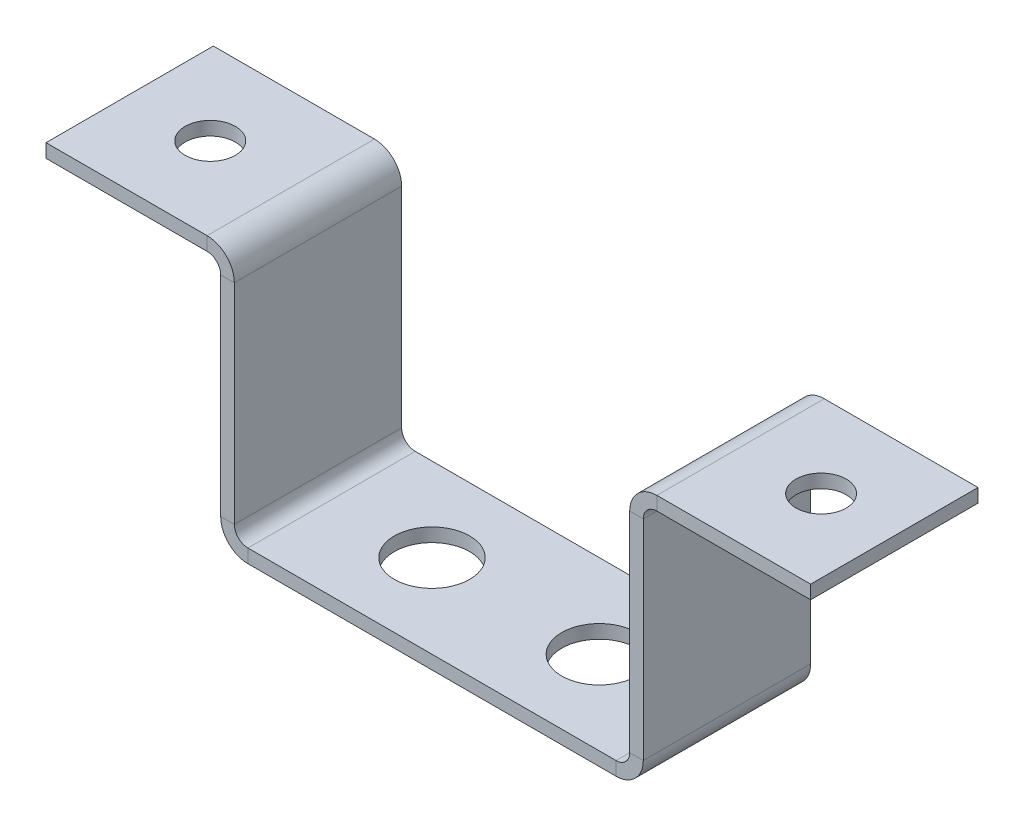
from build123d import *

# Parameters (mm, degrees)
SKETCH2_W                    = 22
SKETCH2_H                    = 10
BOSS_EXTRUDE1_DEPTH          = 0.8128
EDGE_FLANGE1_DEPTH           = 10
EDGE_FLANGE2_DEPTH           = 10
EDGE_FLANGE3_STRIP_W         = 4.8768
EDGE_FLANGE3_STRIP_H         = 0.8128
EDGE_FLANGE3_STRIP_CUT_DEPTH = 10
EDGE_FLANGE3_DEPTH           = 10
EDGE_FLANGE4_STRIP_W         = 4.8768
EDGE_FLANGE4_STRIP_H         = 0.8128
EDGE_FLANGE4_STRIP_CUT_DEPTH = 10
EDGE_FLANGE4_DEPTH           = 10
CUT_EXTRUDE1_REACH           = 40.457
SKETCH21_R                   = 1.5
CUT_EXTRUDE2_REACH           = 40.457
SKETCH22_R                   = 2.25


# Sheet-metal steps are written as plain solids
with BuildPart() as part:
    # Sketch2 → Boss-Extrude1 (new body)
    with BuildSketch(Plane(origin=(0, 0, 0), x_dir=(1, 0, 0), z_dir=(0, 1, 0))):
        with Locations((11, 5)):
            Rectangle(SKETCH2_W, SKETCH2_H)
    extrude(amount=BOSS_EXTRUDE1_DEPTH)

    # Edge-Flange1 section (across the edge) → Edge-Flange1 (add)
    with BuildSketch(Plane(origin=(-0.8128, 0.8128, -10), x_dir=(1, 0, 0), z_dir=(0, 0, 1))):
        with BuildLine():
            Line((-0.8128, 0.8128), (-0.8128, 14.13))
            Line((-0.8128, 14.13), (0, 14.13))
            Line((0, 14.13), (0, 0.8128))
            ThreePointArc((0, 0.8128), (0.238063608, 0.238063608), (0.8128, 0))
            Line((0.8128, 0), (0.8128, -0.8128))
            ThreePointArc((0.8128, -0.8128), (-0.336672783, -0.336672783), (-0.8128, 0.8128))
        make_face()
    extrude(amount=EDGE_FLANGE1_DEPTH)

    # Edge-Flange2 section (across the edge) → Edge-Flange2 (add)
    with BuildSketch(Plane(origin=(22.8128, 0.8128, 0), x_dir=(-1, 0, 0), z_dir=(0, 0, -1))):
        with BuildLine():
            Line((-0.8128, 0.8128), (-0.8128, 14.13))
            Line((-0.8128, 14.13), (0, 14.13))
            Line((0, 14.13), (0, 0.8128))
            ThreePointArc((0, 0.8128), (0.238063608, 0.238063608), (0.8128, 0))
            Line((0.8128, 0), (0.8128, -0.8128))
            ThreePointArc((0.8128, -0.8128), (-0.336672783, -0.336672783), (-0.8128, 0.8128))
        make_face()
    extrude(amount=EDGE_FLANGE2_DEPTH)

    # Edge-Flange3 strip (across the edge) → Edge-Flange3 strip cut (cut)
    with BuildSketch(Plane(origin=(-1.6256, 14.9428, 0), x_dir=(0, -1, 0), z_dir=(0, 0, -1))):
        with Locations((-1.6256, -0.4064)):
            Rectangle(EDGE_FLANGE3_STRIP_W, EDGE_FLANGE3_STRIP_H)
    extrude(amount=EDGE_FLANGE3_STRIP_CUT_DEPTH, mode=Mode.SUBTRACT)

    # Edge-Flange3 section (across the edge) → Edge-Flange3 (add)
    with BuildSketch(Plane(origin=(-1.6256, 14.9428, 0), x_dir=(0, -1, 0), z_dir=(0, 0, -1))):
        with BuildLine():
            Line((-0.8128, 0.8128), (-0.8128, 10.4384))
            Line((-0.8128, 10.4384), (0, 10.4384))
            Line((0, 10.4384), (0, 0.8128))
            ThreePointArc((0, 0.8128), (0.238063608, 0.238063608), (0.8128, 0))
            Line((0.8128, 0), (0.8128, -0.8128))
            ThreePointArc((0.8128, -0.8128), (-0.336672783, -0.336672783), (-0.8128, 0.8128))
        make_face()
    extrude(amount=EDGE_FLANGE3_DEPTH)

    # Edge-Flange4 strip (across the edge) → Edge-Flange4 strip cut (cut)
    with BuildSketch(Plane(origin=(23.6256, 14.9428, -10), x_dir=(0, -1, 0), z_dir=(0, 0, 1))):
        with Locations((-1.6256, -0.4064)):
            Rectangle(EDGE_FLANGE4_STRIP_W, EDGE_FLANGE4_STRIP_H)
    extrude(amount=EDGE_FLANGE4_STRIP_CUT_DEPTH, mode=Mode.SUBTRACT)

    # Edge-Flange4 section (across the edge) → Edge-Flange4 (add)
    with BuildSketch(Plane(origin=(23.6256, 14.9428, -10), x_dir=(0, -1, 0), z_dir=(0, 0, 1))):
        with BuildLine():
            Line((-0.8128, 0.8128), (-0.8128, 10))
            Line((-0.8128, 10), (0, 10))
            Line((0, 10), (0, 0.8128))
            ThreePointArc((0, 0.8128), (0.238063608, 0.238063608), (0.8128, 0))
            Line((0.8128, 0), (0.8128, -0.8128))
            ThreePointArc((0.8128, -0.8128), (-0.336672783, -0.336672783), (-0.8128, 0.8128))
        make_face()
    extrude(amount=EDGE_FLANGE4_DEPTH)

    # Sketch21 → Cut-Extrude1 (cut, up to next)
    with BuildSketch(Plane(origin=(0, 15.7556, 0), x_dir=(1, 0, 0), z_dir=(0, 1, 0)), mode=Mode.PRIVATE) as cut_extrude1_sk1:
        with Locations(Location((-7.2512, 5, 0), (0, 0, 270))):
            Circle(SKETCH21_R)
    cut_extrude1_tool1 = extrude(cut_extrude1_sk1.sketch, amount=-CUT_EXTRUDE1_REACH, mode=Mode.PRIVATE) & part.part
    # Sketch21 → Cut-Extrude1 (cut, up to next)
    with BuildSketch(Plane(origin=(0, 15.7556, 0), x_dir=(1, 0, 0), z_dir=(0, 1, 0)), mode=Mode.PRIVATE) as cut_extrude1_sk2:
        with Locations(Location((29.2512, 5, 0), (0, 0, 90))):
            Circle(SKETCH21_R)
    cut_extrude1_tool2 = extrude(cut_extrude1_sk2.sketch, amount=-CUT_EXTRUDE1_REACH, mode=Mode.PRIVATE) & part.part
    add(cut_extrude1_tool1.solids().sort_by_distance((-7.2512, 15.7556, -5))[0], mode=Mode.SUBTRACT)
    add(cut_extrude1_tool2.solids().sort_by_distance((29.2512, 15.7556, -5))[0], mode=Mode.SUBTRACT)

    # Sketch22 → Cut-Extrude2 (cut, up to next)
    with BuildSketch(Plane.XZ, mode=Mode.PRIVATE) as cut_extrude2_sk1:
        with Locations(Location((6, -5, 0), (0, 0, 270))):
            Circle(SKETCH22_R)
    cut_extrude2_tool1 = extrude(cut_extrude2_sk1.sketch, amount=-CUT_EXTRUDE2_REACH, mode=Mode.PRIVATE) & part.part
    # Sketch22 → Cut-Extrude2 (cut, up to next)
    with BuildSketch(Plane.XZ, mode=Mode.PRIVATE) as cut_extrude2_sk2:
        with Locations(Location((16, -5, 0), (0, 0, 270))):
            Circle(SKETCH22_R)
    cut_extrude2_tool2 = extrude(cut_extrude2_sk2.sketch, amount=-CUT_EXTRUDE2_REACH, mode=Mode.PRIVATE) & part.part
    add(cut_extrude2_tool1.solids().sort_by_distance((6, 0, -5))[0], mode=Mode.SUBTRACT)
    add(cut_extrude2_tool2.solids().sort_by_distance((16, 0, -5))[0], mode=Mode.SUBTRACT)


solid = part.part
